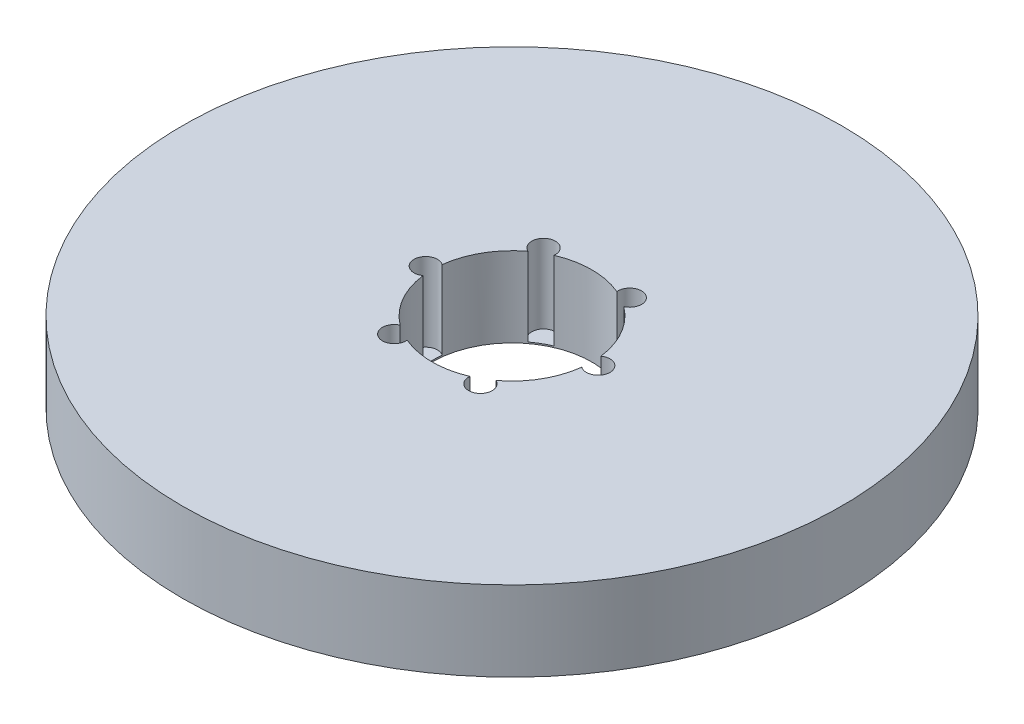
from build123d import *

# Parameters (mm, degrees)
SKETCH1_R           = 82.5
BOSS_EXTRUDE1_DEPTH = 20
SKETCH2_R           = 20
CUT_EXTRUDE1_DEPTH  = 119.374406018
SKETCH3_R           = 2.947072101
CUT_EXTRUDE2_DEPTH  = 19.66273413
CIRPATTERN1_COUNT   = 6


with BuildPart() as part:
    # Sketch1 → Boss-Extrude1 (new body)
    with BuildSketch(Plane(origin=(0, 0, 0), x_dir=(1, 0, 0), z_dir=(0, 1, 0))):
        Circle(SKETCH1_R)
    extrude(amount=BOSS_EXTRUDE1_DEPTH)

    # Sketch2 → Cut-Extrude1 (cut, through all)
    with BuildSketch(Plane(origin=(0, 0, 0), x_dir=(1, 0, 0), z_dir=(0, 1, 0))):
        Circle(SKETCH2_R)
    extrude(amount=CUT_EXTRUDE1_DEPTH, mode=Mode.SUBTRACT)

    # Sketch3 → Cut-Extrude2 (cut)
    with BuildSketch(Plane(origin=(0, 20, 0), x_dir=(1, 0, 0), z_dir=(0, 1, 0))):
        with Locations((-21.58128489, 0)):
            Circle(SKETCH3_R)
    cut_extrude2 = extrude(amount=-CUT_EXTRUDE2_DEPTH, mode=Mode.SUBTRACT)

    # CirPattern1: Cut-Extrude2 ×6 about axis
    cirpattern1_axis = Axis((0, 0, 0), (0, 1, 0))
    for i in range(1, CIRPATTERN1_COUNT):
        add(cut_extrude2.rotate(cirpattern1_axis, i * 360 / CIRPATTERN1_COUNT), mode=Mode.SUBTRACT)


solid = part.part
